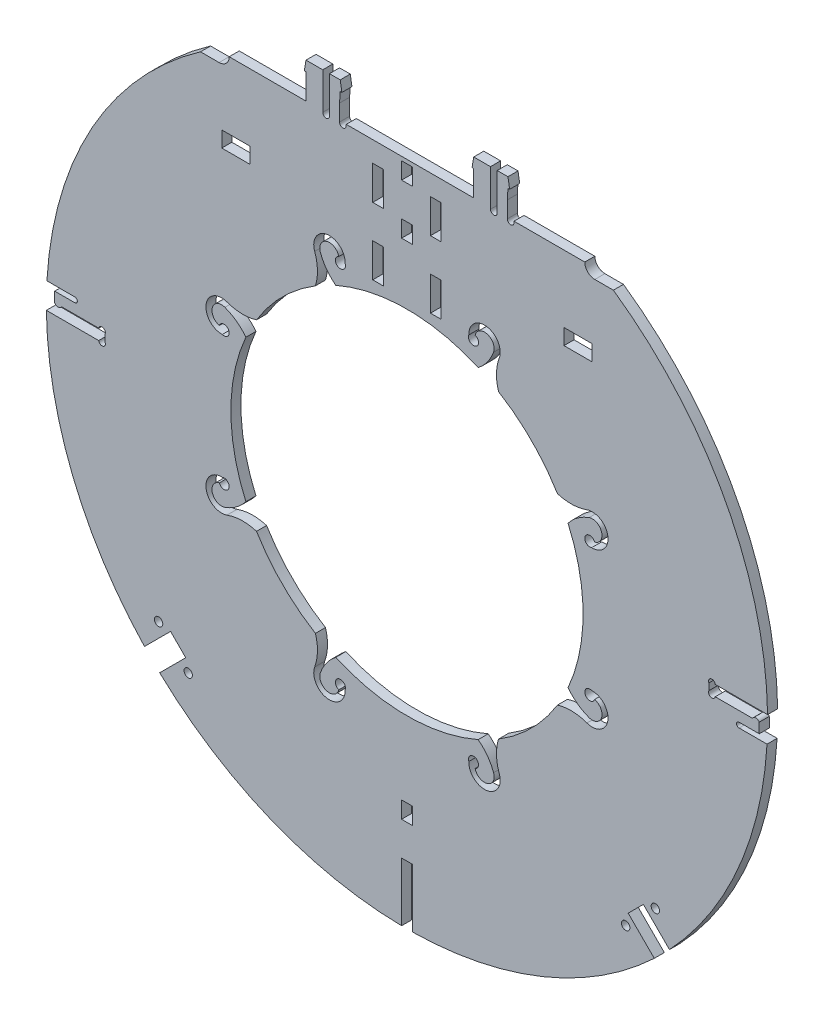
from build123d import *

# Parameters (mm, degrees)
SKETCH1_R                     = 107.5
SKETCH1_R_2                   = 52.5
BOSS_EXTRUDE1_DEPTH           = 3
FACE_FLATTENING_REACH         = 154.058
SIDE_RIB_SLOT_REACH           = 154.058
SIDE_RIB_SLOT_PATTERN_COUNT   = 2
FRONT_BACK_RIB_TAB_SLOT_REACH = 154.05
SKETCH5_W                     = 3.2
SKETCH5_H                     = 5
EYE_PLATE_SLOTS_REACH         = 154.041
SKETCH3_W                     = 8.4
SKETCH3_H                     = 4.684444021
SKETCH3_W_2                   = 3.2
SKETCH3_H_2                   = 10.1
FACE_START                    = -3
FACE_PLATE_TABS_OUTLINE_W     = 2
FACE_PLATE_TABS_OUTLINE_H     = 4.476977338
FACE_PLATE_TABS_DEPTH         = 3
SKETCH11_W                    = 2
SKETCH11_H                    = 4.476977338
FACE_PLATE_TAB_RELIEF_DEPTH   = 3
EYE_PLATE_RELIEF_REACH        = 154.041
TOUCH_SWITCH_SLOTS_REACH      = 154.041
SKETCH6_R                     = 1.25
ELASTIC_SLOTS_REACH           = 154.041


# Read off the part's stored shape, not the designer's step: face plate tabs
with BuildPart() as part:
    # Sketch1 → Boss-Extrude1 (new body)
    with BuildSketch(Plane.XY):
        Circle(SKETCH1_R)
        Circle(SKETCH1_R_2, mode=Mode.SUBTRACT)
    extrude(amount=BOSS_EXTRUDE1_DEPTH)

    # Sketch9 → face flattening (cut, up to next)
    with BuildSketch(Plane.XY.offset(3), mode=Mode.PRIVATE) as face_flattening_sk1:
        Polygon((-56.994883479, 91.147316237), (0, 91.147316237), (56.994883479, 91.147316237), (56.994883479, 107.5), (-56.994883479, 107.5), align=None)
    face_flattening_tool1 = extrude(face_flattening_sk1.sketch, amount=-FACE_FLATTENING_REACH, mode=Mode.PRIVATE) & part.part
    add(face_flattening_tool1.solids().sort_by_distance((0, 99.323658, 3))[0], mode=Mode.SUBTRACT)

    # Sketch2 → side rib slot (cut, up to next)
    with BuildSketch(Plane.XY.offset(3), mode=Mode.PRIVATE) as side_rib_slot_sk1:
        with BuildLine():
            Line((-105, 1.635889894), (-105, 4.635889894))
            Line((-105, 4.635889894), (-99, 4.635889894))
            ThreePointArc((-99, 4.635889894), (-98.25, 5.385889894), (-99, 6.135889894))
            Line((-99, 6.135889894), (-120, 6.135889894))
            Line((-120, 6.135889894), (-120, -1.564110106))
            Line((-120, -1.564110106), (-105, -1.564110106))
            Line((-105, -1.564110106), (-91.891745722, -1.564110106))
            ThreePointArc((-91.891745722, -1.564110106), (-90.61423896, -2.394190801), (-90, -1))
            Line((-90, -1), (-90, 1))
            ThreePointArc((-90, 1), (-90.579561495, 2.383159214), (-91.879795897, 1.635889894))
            Line((-91.879795897, 1.635889894), (-103, 1.635889894))
            ThreePointArc((-103, 1.635889894), (-104, 1.035889894), (-105, 1.635889894))
        make_face()
    side_rib_slot_tool1 = extrude(side_rib_slot_sk1.sketch, amount=-SIDE_RIB_SLOT_REACH, mode=Mode.PRIVATE) & part.part
    side_rib_slot = side_rib_slot_tool1.solids().sort_by_distance((-107.501797, 1.813578, 3))[0]
    add(side_rib_slot, mode=Mode.SUBTRACT)

    # side rib slot pattern: side rib slot ×2 about axis
    side_rib_slot_pattern_axis = Axis((0, 0, 0), (0, 0, 1))
    for i in range(1, SIDE_RIB_SLOT_PATTERN_COUNT):
        add(side_rib_slot.rotate(side_rib_slot_pattern_axis, i * 360 / SIDE_RIB_SLOT_PATTERN_COUNT), mode=Mode.SUBTRACT)

    # Sketch5 → front back rib tab slot (cut, up to next)
    with BuildSketch(Plane.XY.offset(3), mode=Mode.PRIVATE) as front_back_rib_tab_slot_sk1:
        with Locations((0, -77.5)):
            Rectangle(SKETCH5_W, SKETCH5_H)
    front_back_rib_tab_slot_tool1 = extrude(front_back_rib_tab_slot_sk1.sketch, amount=-FRONT_BACK_RIB_TAB_SLOT_REACH, mode=Mode.PRIVATE) & part.part
    # Sketch5 → front back rib tab slot (cut, up to next)
    with BuildSketch(Plane.XY.offset(3), mode=Mode.PRIVATE) as front_back_rib_tab_slot_sk2:
        Polygon((-1.6, -90), (1.6, -90), (1.6, -95), (1.6, -107.5), (-1.6, -107.5), (-1.6, -95), align=None)
    front_back_rib_tab_slot_tool2 = extrude(front_back_rib_tab_slot_sk2.sketch, amount=-FRONT_BACK_RIB_TAB_SLOT_REACH, mode=Mode.PRIVATE) & part.part
    # Sketch5 → front back rib tab slot (cut, up to next)
    with BuildSketch(Plane.XY.offset(3), mode=Mode.PRIVATE) as front_back_rib_tab_slot_sk3:
        with Locations((0, 87.5)):
            Rectangle(SKETCH5_W, SKETCH5_H)
    front_back_rib_tab_slot_tool3 = extrude(front_back_rib_tab_slot_sk3.sketch, amount=-FRONT_BACK_RIB_TAB_SLOT_REACH, mode=Mode.PRIVATE) & part.part
    # Sketch5 → front back rib tab slot (cut, up to next)
    with BuildSketch(Plane.XY.offset(3), mode=Mode.PRIVATE) as front_back_rib_tab_slot_sk4:
        with Locations((0, 72.5)):
            Rectangle(SKETCH5_W, SKETCH5_H)
    front_back_rib_tab_slot_tool4 = extrude(front_back_rib_tab_slot_sk4.sketch, amount=-FRONT_BACK_RIB_TAB_SLOT_REACH, mode=Mode.PRIVATE) & part.part
    add(front_back_rib_tab_slot_tool1.solids().sort_by_distance((0, -77.5, 3))[0], mode=Mode.SUBTRACT)
    add(front_back_rib_tab_slot_tool2.solids().sort_by_distance((0, -98.75, 3))[0], mode=Mode.SUBTRACT)
    add(front_back_rib_tab_slot_tool3.solids().sort_by_distance((0, 87.5, 3))[0], mode=Mode.SUBTRACT)
    add(front_back_rib_tab_slot_tool4.solids().sort_by_distance((0, 72.5, 3))[0], mode=Mode.SUBTRACT)

    # Sketch3 → eye plate slots (cut, up to next)
    with BuildSketch(Plane.XY.offset(3), mode=Mode.PRIVATE) as eye_plate_slots_sk1:
        with Locations((-51, 68.81344948)):
            Rectangle(SKETCH3_W, SKETCH3_H)
    eye_plate_slots_tool1 = extrude(eye_plate_slots_sk1.sketch, amount=-EYE_PLATE_SLOTS_REACH, mode=Mode.PRIVATE) & part.part
    # Sketch3 → eye plate slots (cut, up to next)
    with BuildSketch(Plane.XY.offset(3), mode=Mode.PRIVATE) as eye_plate_slots_sk2:
        with Locations((51, 68.81344948)):
            Rectangle(SKETCH3_W, SKETCH3_H)
    eye_plate_slots_tool2 = extrude(eye_plate_slots_sk2.sketch, amount=-EYE_PLATE_SLOTS_REACH, mode=Mode.PRIVATE) & part.part
    # Sketch3 → eye plate slots (cut, up to next)
    with BuildSketch(Plane.XY.offset(3), mode=Mode.PRIVATE) as eye_plate_slots_sk3:
        with Locations((8.6, 60)):
            Rectangle(SKETCH3_W_2, SKETCH3_H_2)
    eye_plate_slots_tool3 = extrude(eye_plate_slots_sk3.sketch, amount=-EYE_PLATE_SLOTS_REACH, mode=Mode.PRIVATE) & part.part
    # Sketch3 → eye plate slots (cut, up to next)
    with BuildSketch(Plane.XY.offset(3), mode=Mode.PRIVATE) as eye_plate_slots_sk4:
        with Locations((8.6, 80)):
            Rectangle(SKETCH3_W_2, SKETCH3_H_2)
    eye_plate_slots_tool4 = extrude(eye_plate_slots_sk4.sketch, amount=-EYE_PLATE_SLOTS_REACH, mode=Mode.PRIVATE) & part.part
    # Sketch3 → eye plate slots (cut, up to next)
    with BuildSketch(Plane.XY.offset(3), mode=Mode.PRIVATE) as eye_plate_slots_sk5:
        with Locations((-8.6, 60)):
            Rectangle(SKETCH3_W_2, SKETCH3_H_2)
    eye_plate_slots_tool5 = extrude(eye_plate_slots_sk5.sketch, amount=-EYE_PLATE_SLOTS_REACH, mode=Mode.PRIVATE) & part.part
    # Sketch3 → eye plate slots (cut, up to next)
    with BuildSketch(Plane.XY.offset(3), mode=Mode.PRIVATE) as eye_plate_slots_sk6:
        with Locations((-8.6, 80)):
            Rectangle(SKETCH3_W_2, SKETCH3_H_2)
    eye_plate_slots_tool6 = extrude(eye_plate_slots_sk6.sketch, amount=-EYE_PLATE_SLOTS_REACH, mode=Mode.PRIVATE) & part.part
    add(eye_plate_slots_tool1.solids().sort_by_distance((-51, 68.813449, 3))[0], mode=Mode.SUBTRACT)
    add(eye_plate_slots_tool2.solids().sort_by_distance((51, 68.813449, 3))[0], mode=Mode.SUBTRACT)
    add(eye_plate_slots_tool3.solids().sort_by_distance((8.6, 60, 3))[0], mode=Mode.SUBTRACT)
    add(eye_plate_slots_tool4.solids().sort_by_distance((8.6, 80, 3))[0], mode=Mode.SUBTRACT)
    add(eye_plate_slots_tool5.solids().sort_by_distance((-8.6, 60, 3))[0], mode=Mode.SUBTRACT)
    add(eye_plate_slots_tool6.solids().sort_by_distance((-8.6, 80, 3))[0], mode=Mode.SUBTRACT)

    # face plate tabs outline → face plate tabs (add)
    with BuildSketch(Plane.XY.offset(3).offset(FACE_START)):
        Polygon((24.9, 91.147316237), (24.9, 101.724293575), (19.9, 101.724293575), (19.4, 98.724293575), (19.9, 98.724293575), (19.9, 95.624293575), (17.9, 95.624293575), (17.9, 91.147316237), align=None)
        with Locations((32.9, 93.385804906)):
            Rectangle(FACE_PLATE_TABS_OUTLINE_W, FACE_PLATE_TABS_OUTLINE_H)
        Polygon((26.9, 101.724293575), (26.9, 91.147316237), (29.9, 91.147316237), (29.9, 95.624293575), (30.1, 98.724293575), (30.6, 98.724293575), (30.1, 101.724293575), align=None)
        Polygon((-32.1, 91.147316237), (-25.1, 91.147316237), (-25.1, 101.724293575), (-30.1, 101.724293575), (-30.6, 98.724293575), (-30.1, 98.724293575), (-30.1, 95.624293575), (-32.1, 95.624293575), align=None)
        Polygon((-23.1, 91.147316237), (-20.1, 91.147316237), (-20.1, 95.624293575), (-19.9, 98.724293575), (-19.4, 98.724293575), (-19.9, 101.724293575), (-23.1, 101.724293575), align=None)
        with Locations((-17.1, 93.385804906)):
            Rectangle(FACE_PLATE_TABS_OUTLINE_W, FACE_PLATE_TABS_OUTLINE_H)
    extrude(amount=FACE_PLATE_TABS_DEPTH)

    # Sketch11 → face plate tab relief (cut)
    with BuildSketch(Plane.XY.offset(3).offset(FACE_START)):
        with BuildLine():
            Line((29.9, 90.724293575), (29.9, 91.147316237))
            Line((29.9, 91.147316237), (31.9, 95.624293575))
            Line((31.9, 95.624293575), (33.9, 95.624293575))
            Line((33.9, 95.624293575), (33.9, 91.147316237))
            Line((33.9, 91.147316237), (31.9, 91.147316237))
            Line((31.9, 91.147316237), (31.9, 90.724293575))
            ThreePointArc((31.9, 90.724293575), (30.9, 89.724293575), (29.9, 90.724293575))
        make_face()
        with BuildLine():
            Line((24.9, 90.724293575), (24.9, 91.147316237))
            Line((24.9, 91.147316237), (26.9, 91.147316237))
            Line((26.9, 91.147316237), (26.9, 90.724293575))
            ThreePointArc((26.9, 90.724293575), (25.9, 89.724293575), (24.9, 90.724293575))
        make_face()
        with Locations((18.9, 93.385804906)):
            Rectangle(SKETCH11_W, SKETCH11_H)
        with BuildLine():
            Line((-25.1, 90.724293575), (-25.1, 91.147316237))
            Line((-25.1, 91.147316237), (-23.1, 91.147316237))
            Line((-23.1, 91.147316237), (-23.1, 90.724293575))
            ThreePointArc((-23.1, 90.724293575), (-24.1, 89.724293575), (-25.1, 90.724293575))
        make_face()
        with BuildLine():
            Line((-20.1, 90.724293575), (-20.1, 91.147316237))
            Line((-20.1, 91.147316237), (-18.1, 95.624293575))
            Line((-18.1, 95.624293575), (-16.1, 95.624293575))
            Line((-16.1, 95.624293575), (-16.1, 91.147316237))
            Line((-16.1, 91.147316237), (-18.1, 91.147316237))
            Line((-18.1, 91.147316237), (-18.1, 90.724293575))
            ThreePointArc((-18.1, 90.724293575), (-19.1, 89.724293575), (-20.1, 90.724293575))
        make_face()
        with Locations((-31.1, 93.385804906)):
            Rectangle(SKETCH11_W, SKETCH11_H)
    extrude(amount=FACE_PLATE_TAB_RELIEF_DEPTH, mode=Mode.SUBTRACT)

    # Sketch12 → eye plate relief (cut, up to next)
    with BuildSketch(Plane.XY.offset(3), mode=Mode.PRIVATE) as eye_plate_relief_sk1:
        with BuildLine():
            Line((61.532923221, 88.147316237), (55.994883479, 88.147316237))
            ThreePointArc((55.994883479, 88.147316237), (53.873563135, 89.025995894), (52.994883479, 91.147316237))
            Line((52.994883479, 91.147316237), (61.532923221, 91.147316237))
            Line((61.532923221, 91.147316237), (61.532923221, 88.147316237))
        make_face()
    eye_plate_relief_tool1 = extrude(eye_plate_relief_sk1.sketch, amount=-EYE_PLATE_RELIEF_REACH, mode=Mode.PRIVATE) & part.part
    # Sketch12 → eye plate relief (cut, up to next)
    with BuildSketch(Plane.XY.offset(3), mode=Mode.PRIVATE) as eye_plate_relief_sk2:
        with BuildLine():
            Line((-61.532923221, 91.147316237), (-61.532923221, 88.147316237))
            Line((-61.532923221, 88.147316237), (-55.994883479, 88.147316237))
            ThreePointArc((-55.994883479, 88.147316237), (-53.873563135, 89.025995894), (-52.994883479, 91.147316237))
            Line((-52.994883479, 91.147316237), (-61.532923221, 91.147316237))
        make_face()
    eye_plate_relief_tool2 = extrude(eye_plate_relief_sk2.sketch, amount=-EYE_PLATE_RELIEF_REACH, mode=Mode.PRIVATE) & part.part
    add(eye_plate_relief_tool1.solids().sort_by_distance((57.557409, 89.714997, 3))[0], mode=Mode.SUBTRACT)
    add(eye_plate_relief_tool2.solids().sort_by_distance((-57.557409, 89.714997, 3))[0], mode=Mode.SUBTRACT)

    # Sketch6 → touch switch slots (cut, up to next)
    with BuildSketch(Plane.XY.offset(3), mode=Mode.PRIVATE) as touch_switch_slots_sk1:
        with Locations((65.196915085, -74.035749849)):
            Circle(SKETCH6_R)
    touch_switch_slots_tool1 = extrude(touch_switch_slots_sk1.sketch, amount=-TOUCH_SWITCH_SLOTS_REACH, mode=Mode.PRIVATE) & part.part
    # Sketch6 → touch switch slots (cut, up to next)
    with BuildSketch(Plane.XY.offset(3), mode=Mode.PRIVATE) as touch_switch_slots_sk2:
        with Locations((74.035749849, -65.196915085)):
            Circle(SKETCH6_R)
    touch_switch_slots_tool2 = extrude(touch_switch_slots_sk2.sketch, amount=-TOUCH_SWITCH_SLOTS_REACH, mode=Mode.PRIVATE) & part.part
    # Sketch6 → touch switch slots (cut, up to next)
    with BuildSketch(Plane.XY.offset(3), mode=Mode.PRIVATE) as touch_switch_slots_sk3:
        with Locations((-65.196915085, -74.035749849)):
            Circle(SKETCH6_R)
    touch_switch_slots_tool3 = extrude(touch_switch_slots_sk3.sketch, amount=-TOUCH_SWITCH_SLOTS_REACH, mode=Mode.PRIVATE) & part.part
    # Sketch6 → touch switch slots (cut, up to next)
    with BuildSketch(Plane.XY.offset(3), mode=Mode.PRIVATE) as touch_switch_slots_sk4:
        with Locations((-74.035749849, -65.196915085)):
            Circle(SKETCH6_R)
    touch_switch_slots_tool4 = extrude(touch_switch_slots_sk4.sketch, amount=-TOUCH_SWITCH_SLOTS_REACH, mode=Mode.PRIVATE) & part.part
    # Sketch6 → touch switch slots (cut, up to next)
    with BuildSketch(Plane.XY.offset(3), mode=Mode.PRIVATE) as touch_switch_slots_sk5:
        with BuildLine():
            Line((73.717551798, -78.243035198), (65.939377205, -70.464860604))
            Line((65.939377205, -70.464860604), (70.464860604, -65.939377205))
            Line((70.464860604, -65.939377205), (78.243035198, -73.717551798))
            ThreePointArc((78.243035198, -73.717551798), (78.243035198, -78.243035198), (73.717551798, -78.243035198))
        make_face()
    touch_switch_slots_tool5 = extrude(touch_switch_slots_sk5.sketch, amount=-TOUCH_SWITCH_SLOTS_REACH, mode=Mode.PRIVATE) & part.part
    # Sketch6 → touch switch slots (cut, up to next)
    with BuildSketch(Plane.XY.offset(3), mode=Mode.PRIVATE) as touch_switch_slots_sk6:
        with BuildLine():
            Line((-65.939377205, -70.464860604), (-70.464860604, -65.939377205))
            Line((-70.464860604, -65.939377205), (-78.243035198, -73.717551798))
            ThreePointArc((-78.243035198, -73.717551798), (-78.243035198, -78.243035198), (-73.717551798, -78.243035198))
            Line((-73.717551798, -78.243035198), (-65.939377205, -70.464860604))
        make_face()
    touch_switch_slots_tool6 = extrude(touch_switch_slots_sk6.sketch, amount=-TOUCH_SWITCH_SLOTS_REACH, mode=Mode.PRIVATE) & part.part
    add(touch_switch_slots_tool1.solids().sort_by_distance((65.196915, -74.03575, 3))[0], mode=Mode.SUBTRACT)
    add(touch_switch_slots_tool2.solids().sort_by_distance((74.03575, -65.196915, 3))[0], mode=Mode.SUBTRACT)
    add(touch_switch_slots_tool3.solids().sort_by_distance((-65.196915, -74.03575, 3))[0], mode=Mode.SUBTRACT)
    add(touch_switch_slots_tool4.solids().sort_by_distance((-74.03575, -65.196915, 3))[0], mode=Mode.SUBTRACT)
    add(touch_switch_slots_tool5.solids().sort_by_distance((72.993129, -72.993129, 3))[0], mode=Mode.SUBTRACT)
    add(touch_switch_slots_tool6.solids().sort_by_distance((-72.993129, -72.993129, 3))[0], mode=Mode.SUBTRACT)

    # Sketch7 → elastic slots (cut, up to next)
    with BuildSketch(Plane.XY.offset(3), mode=Mode.PRIVATE) as elastic_slots_sk1:
        with BuildLine():
            ThreePointArc((-18.440296556, -55.048751639), (-20.471095705, -53.142710325), (-20.316355879, -55.923572469))
            ThreePointArc((-20.316355879, -55.923572469), (-23.945136393, -58.003806226), (-25.818522196, -54.264040707))
            ThreePointArc((-25.818522196, -54.264040707), (-24.012822249, -50.868249748), (-21.340905339, -48.101878739))
            ThreePointArc((-21.340905339, -48.101878739), (-16.799935389, -45.754918182), (-11.716400288, -45.219845462))
            Line((-11.716400288, -45.219845462), (-32.499324394, -37.655479707))
            ThreePointArc((-32.499324394, -37.655479707), (-28.949048693, -41.333002567), (-26.979061063, -46.049757879))
            ThreePointArc((-26.979061063, -46.049757879), (-26.71044297, -49.886396102), (-27.509968913, -53.648404449))
            ThreePointArc((-27.509968913, -53.648404449), (-23.82788547, -59.871628303), (-18.440296556, -55.048751639))
        make_face()
    elastic_slots_tool1 = extrude(elastic_slots_sk1.sketch, amount=-ELASTIC_SLOTS_REACH, mode=Mode.PRIVATE) & part.part
    # Sketch7 → elastic slots (cut, up to next)
    with BuildSketch(Plane.XY.offset(3), mode=Mode.PRIVATE) as elastic_slots_sk2:
        with BuildLine():
            ThreePointArc((18.440296556, -55.048751639), (20.471095705, -53.142710325), (20.316355879, -55.923572469))
            ThreePointArc((20.316355879, -55.923572469), (23.945136393, -58.003806226), (25.818522196, -54.264040707))
            ThreePointArc((25.818522196, -54.264040707), (24.012822249, -50.868249748), (21.340905339, -48.101878739))
            ThreePointArc((21.340905339, -48.101878739), (16.799935389, -45.754918182), (11.716400288, -45.219845462))
            Line((11.716400288, -45.219845462), (32.499324394, -37.655479707))
            ThreePointArc((32.499324394, -37.655479707), (28.949048693, -41.333002567), (26.979061063, -46.049757879))
            ThreePointArc((26.979061063, -46.049757879), (26.71044297, -49.886396102), (27.509968913, -53.648404449))
            ThreePointArc((27.509968913, -53.648404449), (23.82788547, -59.871628303), (18.440296556, -55.048751639))
        make_face()
    elastic_slots_tool2 = extrude(elastic_slots_sk2.sketch, amount=-ELASTIC_SLOTS_REACH, mode=Mode.PRIVATE) & part.part
    # Sketch7 → elastic slots (cut, up to next)
    with BuildSketch(Plane.XY.offset(3), mode=Mode.PRIVATE) as elastic_slots_sk3:
        with BuildLine():
            ThreePointArc((-55.048751639, 18.440296556), (-53.142710325, 20.471095705), (-55.923572469, 20.316355879))
            ThreePointArc((-55.923572469, 20.316355879), (-58.003806226, 23.945136393), (-54.264040707, 25.818522196))
            ThreePointArc((-54.264040707, 25.818522196), (-50.868249748, 24.012822249), (-48.101878739, 21.340905339))
            ThreePointArc((-48.101878739, 21.340905339), (-45.754918182, 16.799935389), (-45.219845462, 11.716400288))
            Line((-45.219845462, 11.716400288), (-37.655479707, 32.499324394))
            ThreePointArc((-37.655479707, 32.499324394), (-41.333002567, 28.949048693), (-46.049757879, 26.979061063))
            ThreePointArc((-46.049757879, 26.979061063), (-49.886396102, 26.71044297), (-53.648404449, 27.509968913))
            ThreePointArc((-53.648404449, 27.509968913), (-59.871628303, 23.82788547), (-55.048751639, 18.440296556))
        make_face()
    elastic_slots_tool3 = extrude(elastic_slots_sk3.sketch, amount=-ELASTIC_SLOTS_REACH, mode=Mode.PRIVATE) & part.part
    # Sketch7 → elastic slots (cut, up to next)
    with BuildSketch(Plane.XY.offset(3), mode=Mode.PRIVATE) as elastic_slots_sk4:
        with BuildLine():
            ThreePointArc((-55.048751639, -18.440296556), (-53.142710325, -20.471095705), (-55.923572469, -20.316355879))
            ThreePointArc((-55.923572469, -20.316355879), (-58.003806226, -23.945136393), (-54.264040707, -25.818522196))
            ThreePointArc((-54.264040707, -25.818522196), (-50.868249748, -24.012822249), (-48.101878739, -21.340905339))
            ThreePointArc((-48.101878739, -21.340905339), (-45.754918182, -16.799935389), (-45.219845462, -11.716400288))
            Line((-45.219845462, -11.716400288), (-37.655479707, -32.499324394))
            ThreePointArc((-37.655479707, -32.499324394), (-41.333002567, -28.949048693), (-46.049757879, -26.979061063))
            ThreePointArc((-46.049757879, -26.979061063), (-49.886396102, -26.71044297), (-53.648404449, -27.509968913))
            ThreePointArc((-53.648404449, -27.509968913), (-59.871628303, -23.82788547), (-55.048751639, -18.440296556))
        make_face()
    elastic_slots_tool4 = extrude(elastic_slots_sk4.sketch, amount=-ELASTIC_SLOTS_REACH, mode=Mode.PRIVATE) & part.part
    # Sketch7 → elastic slots (cut, up to next)
    with BuildSketch(Plane.XY.offset(3), mode=Mode.PRIVATE) as elastic_slots_sk5:
        with BuildLine():
            ThreePointArc((18.440296556, 55.048751639), (20.471095706, 53.142710325), (20.316355879, 55.923572469))
            ThreePointArc((20.316355879, 55.923572469), (23.945136393, 58.003806226), (25.818522196, 54.264040707))
            ThreePointArc((25.818522196, 54.264040707), (24.012822249, 50.868249748), (21.340905339, 48.101878739))
            ThreePointArc((21.340905339, 48.101878739), (16.799935389, 45.754918182), (11.716400288, 45.219845462))
            Line((11.716400288, 45.219845462), (32.499324394, 37.655479707))
            ThreePointArc((32.499324394, 37.655479707), (28.949048693, 41.333002567), (26.979061063, 46.049757879))
            ThreePointArc((26.979061063, 46.049757879), (26.71044297, 49.886396102), (27.509968913, 53.648404449))
            ThreePointArc((27.509968913, 53.648404449), (23.82788547, 59.871628303), (18.440296556, 55.048751639))
        make_face()
    elastic_slots_tool5 = extrude(elastic_slots_sk5.sketch, amount=-ELASTIC_SLOTS_REACH, mode=Mode.PRIVATE) & part.part
    # Sketch7 → elastic slots (cut, up to next)
    with BuildSketch(Plane.XY.offset(3), mode=Mode.PRIVATE) as elastic_slots_sk6:
        with BuildLine():
            ThreePointArc((-18.440296556, 55.048751639), (-20.471095705, 53.142710325), (-20.316355879, 55.923572469))
            ThreePointArc((-20.316355879, 55.923572469), (-23.945136393, 58.003806226), (-25.818522196, 54.264040707))
            ThreePointArc((-25.818522196, 54.264040707), (-24.012822249, 50.868249748), (-21.340905339, 48.101878739))
            ThreePointArc((-21.340905339, 48.101878739), (-16.799935389, 45.754918182), (-11.716400288, 45.219845462))
            Line((-11.716400288, 45.219845462), (-32.499324394, 37.655479707))
            ThreePointArc((-32.499324394, 37.655479707), (-28.949048693, 41.333002567), (-26.979061063, 46.049757879))
            ThreePointArc((-26.979061063, 46.049757879), (-26.71044297, 49.886396102), (-27.509968913, 53.648404449))
            ThreePointArc((-27.509968913, 53.648404449), (-23.82788547, 59.871628303), (-18.440296556, 55.048751639))
        make_face()
    elastic_slots_tool6 = extrude(elastic_slots_sk6.sketch, amount=-ELASTIC_SLOTS_REACH, mode=Mode.PRIVATE) & part.part
    # Sketch7 → elastic slots (cut, up to next)
    with BuildSketch(Plane.XY.offset(3), mode=Mode.PRIVATE) as elastic_slots_sk7:
        with BuildLine():
            ThreePointArc((55.048751639, -18.440296556), (53.142710325, -20.471095706), (55.923572469, -20.316355879))
            ThreePointArc((55.923572469, -20.316355879), (58.003806226, -23.945136393), (54.264040707, -25.818522196))
            ThreePointArc((54.264040707, -25.818522196), (50.868249748, -24.012822249), (48.101878739, -21.340905339))
            ThreePointArc((48.101878739, -21.340905339), (45.754918182, -16.799935389), (45.219845462, -11.716400288))
            Line((45.219845462, -11.716400288), (37.655479707, -32.499324394))
            ThreePointArc((37.655479707, -32.499324394), (41.333002567, -28.949048693), (46.049757879, -26.979061063))
            ThreePointArc((46.049757879, -26.979061063), (49.886396102, -26.71044297), (53.648404449, -27.509968913))
            ThreePointArc((53.648404449, -27.509968913), (59.871628303, -23.82788547), (55.048751639, -18.440296556))
        make_face()
    elastic_slots_tool7 = extrude(elastic_slots_sk7.sketch, amount=-ELASTIC_SLOTS_REACH, mode=Mode.PRIVATE) & part.part
    # Sketch7 → elastic slots (cut, up to next)
    with BuildSketch(Plane.XY.offset(3), mode=Mode.PRIVATE) as elastic_slots_sk8:
        with BuildLine():
            ThreePointArc((55.048751639, 18.440296556), (53.142710325, 20.471095705), (55.923572469, 20.316355879))
            ThreePointArc((55.923572469, 20.316355879), (58.003806226, 23.945136393), (54.264040707, 25.818522196))
            ThreePointArc((54.264040707, 25.818522196), (50.868249748, 24.012822249), (48.101878739, 21.340905339))
            ThreePointArc((48.101878739, 21.340905339), (45.754918182, 16.799935389), (45.219845462, 11.716400288))
            Line((45.219845462, 11.716400288), (37.655479707, 32.499324394))
            ThreePointArc((37.655479707, 32.499324394), (41.333002567, 28.949048693), (46.049757879, 26.979061063))
            ThreePointArc((46.049757879, 26.979061063), (49.886396102, 26.71044297), (53.648404449, 27.509968913))
            ThreePointArc((53.648404449, 27.509968913), (59.871628303, 23.82788547), (55.048751639, 18.440296556))
        make_face()
    elastic_slots_tool8 = extrude(elastic_slots_sk8.sketch, amount=-ELASTIC_SLOTS_REACH, mode=Mode.PRIVATE) & part.part
    add(elastic_slots_tool1.solids().sort_by_distance((-23.293369, -47.937625, 3))[0], mode=Mode.SUBTRACT)
    add(elastic_slots_tool2.solids().sort_by_distance((23.293369, -47.937625, 3))[0], mode=Mode.SUBTRACT)
    add(elastic_slots_tool3.solids().sort_by_distance((-47.937625, 23.293369, 3))[0], mode=Mode.SUBTRACT)
    add(elastic_slots_tool4.solids().sort_by_distance((-47.937625, -23.293369, 3))[0], mode=Mode.SUBTRACT)
    add(elastic_slots_tool5.solids().sort_by_distance((23.293369, 47.937625, 3))[0], mode=Mode.SUBTRACT)
    add(elastic_slots_tool6.solids().sort_by_distance((-23.293369, 47.937625, 3))[0], mode=Mode.SUBTRACT)
    add(elastic_slots_tool7.solids().sort_by_distance((47.937625, -23.293369, 3))[0], mode=Mode.SUBTRACT)
    add(elastic_slots_tool8.solids().sort_by_distance((47.937625, 23.293369, 3))[0], mode=Mode.SUBTRACT)


solid = part.part
